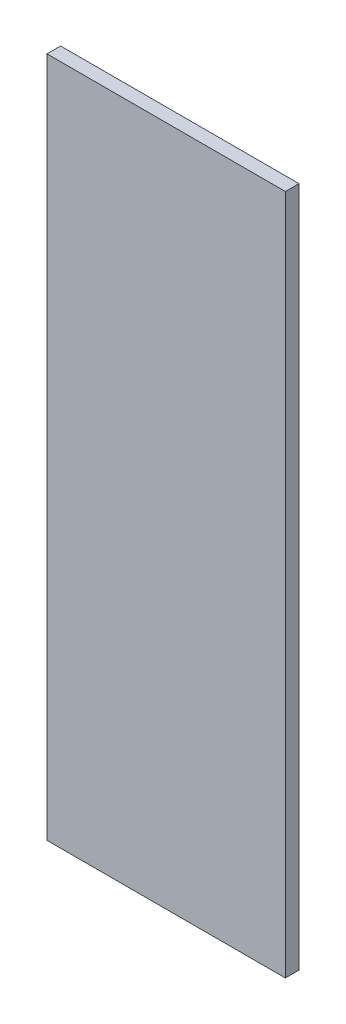
from build123d import *

# Parameters (mm, degrees)
SKETCH1_W           = 28
SKETCH1_H           = 80
BOSS_EXTRUDE1_DEPTH = 1.6


with BuildPart() as part:
    # Sketch1 → Boss-Extrude1 (new body)
    with BuildSketch(Plane.XY):
        with Locations((0, 40)):
            Rectangle(SKETCH1_W, SKETCH1_H)
    extrude(amount=BOSS_EXTRUDE1_DEPTH)


solid = part.part
